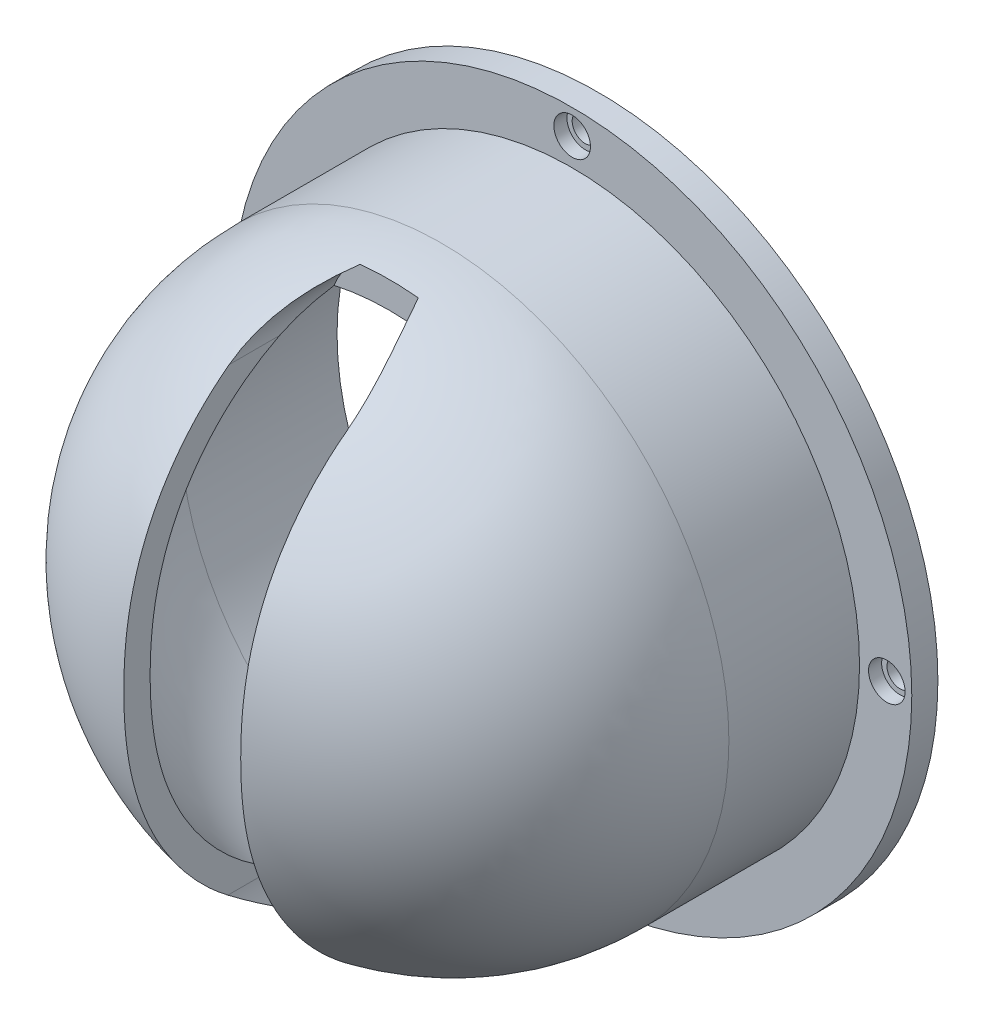
from build123d import *

# Parameters (mm, degrees)
SKETCH2_R           = 65
BOSS_EXTRUDE1_DEPTH = 5
SKETCH3_R           = 55
BOSS_EXTRUDE2_DEPTH = 75
FILLET4_R           = 50
SKETCH7_R           = 2.5
CUT_EXTRUDE2_DEPTH  = 5
SKETCH8_R           = 3.5
CUT_EXTRUDE3_DEPTH  = 2.5
CIRPATTERN1_COUNT   = 4
CUT_EXTRUDE4_DEPTH  = 40


# Read off the part's stored shape, not the designer's step: Shell1
with BuildPart() as part:
    # Sketch2 → Boss-Extrude1 (new body)
    with BuildSketch(Plane(origin=(0, 0, 0), x_dir=(0, 1, 0), z_dir=(0, 0, 1))):
        with Locations(Location((0, 0, 0), (0, 0, 270))):
            Circle(SKETCH2_R)
    extrude(amount=BOSS_EXTRUDE1_DEPTH)

    # Sketch3 → Boss-Extrude2 (add)
    with BuildSketch(Plane.XY.offset(5)):
        Circle(SKETCH3_R)
    extrude(amount=BOSS_EXTRUDE2_DEPTH)

    # Fillet4
    fillet4_edges = [part.edges().sort_by_distance(p)[0] for p in [
        (-55, 0, 80),
    ]]
    fillet(fillet4_edges, radius=FILLET4_R)

    # Shell1 outline → Shell1 (revolve, cut)
    with BuildSketch(Plane.XZ):
        with BuildLine():
            Line((50, 0), (50, 30))
            ThreePointArc((50, 30), (36.819805153, 61.819805153), (5, 75))
            Line((5, 75), (0, 75))
            Line((0, 75), (0, 0))
            Line((0, 0), (50, 0))
        make_face()
    revolve(axis=Axis((0, 0, 0), (0, 0, 1)), mode=Mode.SUBTRACT)

    # Sketch7 → Cut-Extrude2 (cut)
    with BuildSketch(Plane.XY.offset(5)):
        with Locations((0, 60.247846794)):
            Circle(SKETCH7_R)
    cut_extrude2 = extrude(amount=-CUT_EXTRUDE2_DEPTH, mode=Mode.SUBTRACT)

    # Sketch8 → Cut-Extrude3 (cut)
    with BuildSketch(Plane.XY.offset(5)):
        with Locations((0, 60.223600104)):
            Circle(SKETCH8_R)
    cut_extrude3 = extrude(amount=-CUT_EXTRUDE3_DEPTH, mode=Mode.SUBTRACT)

    # CirPattern1: Cut-Extrude2, Cut-Extrude3 ×4 about axis
    cirpattern1_axis = Axis((0, 0, 0), (0, 0, 1))
    add([cut_extrude2.rotate(cirpattern1_axis, i * 360 / CIRPATTERN1_COUNT) for i in range(1, CIRPATTERN1_COUNT)], mode=Mode.SUBTRACT)
    add([cut_extrude3.rotate(cirpattern1_axis, i * 360 / CIRPATTERN1_COUNT) for i in range(1, CIRPATTERN1_COUNT)], mode=Mode.SUBTRACT)

    # Sketch11 → Cut-Extrude4 (cut)
    with BuildSketch(Plane.XY.offset(80)):
        with BuildLine():
            Line((-11.18622175, -43.811794166), (-11.18622175, 43.999528635))
            ThreePointArc((-11.18622175, 43.999528635), (0, 55.185750385), (11.18622175, 43.999528635))
            Line((11.18622175, 43.999528635), (11.18622175, -43.811794166))
            ThreePointArc((11.18622175, -43.811794166), (0, -54.998015916), (-11.18622175, -43.811794166))
        make_face()
    extrude(amount=-CUT_EXTRUDE4_DEPTH, mode=Mode.SUBTRACT)


solid = part.part
